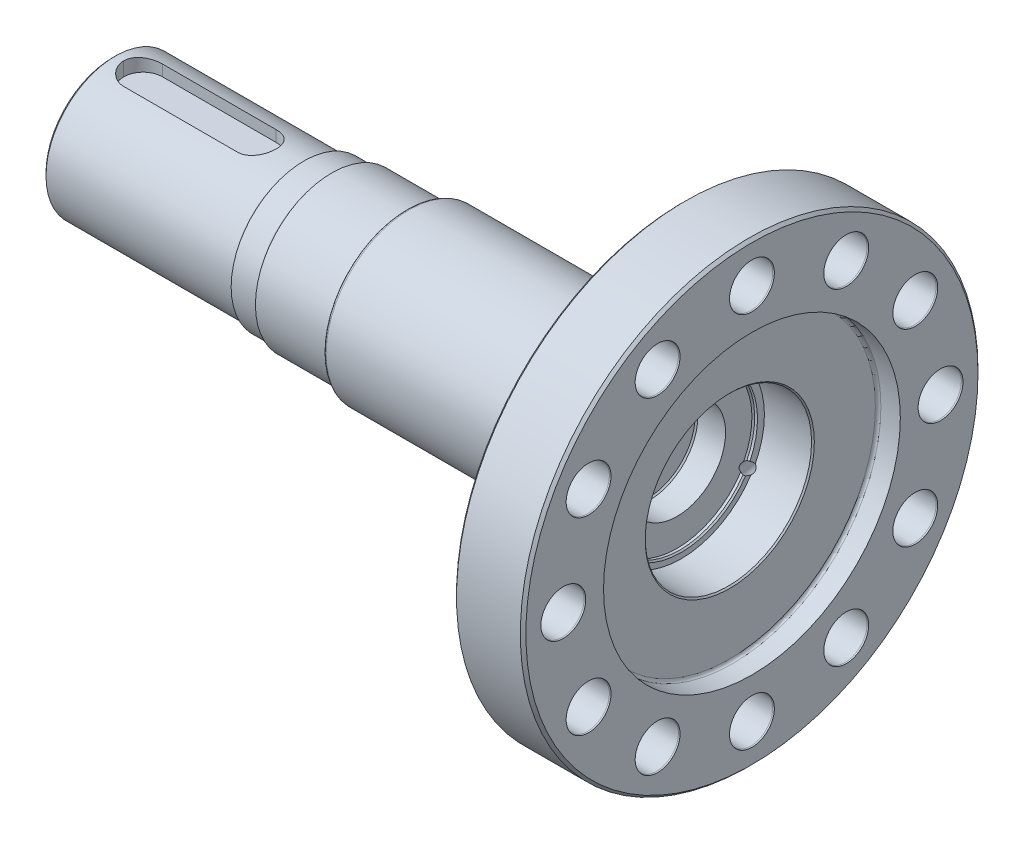
from build123d import *

# Parameters (mm, degrees)
SKETCH_2_R                            = 165
EXTRUDE_1_DEPTH                       = 50
SKETCH_5_R                            = 110
EXTRUDE_2_DEPTH                       = 55
EXTRUDE_2_TAPER                       = 30
SKETCH_7_R                            = 60
EXTRUDE_3_DEPTH                       = 144
SKETCH_8_R                            = 55
EXTRUDE_4_DEPTH                       = 54
SKETCH_9_R                            = 52.5
UNDEF_DEPTH                           = 20
SKETCH_10_R                           = 50
EXTRUDE_6_DEPTH                       = 138
CUT_EXTRUDE_START                     = -118
CUT_EXTRUDE_1_DEPTH                   = 110
FILLET_1_R                            = 14
HOLE_WIZARD_M12_2_D                   = 10.2
HOLE_WIZARD_M12_2_DEPTH               = 36.935610843
HOLE_WIZARD_M12_2_TIP                 = 3.064389157
SKETCH_17_R                           = 107
CUT_EXTRUDE_2_DEPTH                   = 16
SKETCH_18_R                           = 60
CUT_EXTRUDE_3_DEPTH                   = 35
SKETCH_19_R                           = 55
CUT_EXTRUDE_4_DEPTH                   = 3
SKETCH_20_R                           = 35
CUT_EXTRUDE_5_DEPTH                   = 21
CUT_EXTRUDE_6_REACH                   = 518.692
SKETCH_21_R                           = 16
CHAMFER_1_SIZE                        = 1
CHAMFER_1_SIZE2                       = 0.176326981
PATTERN_CIRCULAR_1_COUNT              = 12
CHAMFER_1_OF_PATTERN_CIRCULAR_1_SIZE2 = 1
CHAMFER_1_OF_PATTERN_CIRCULAR_1_SIZE  = 0.176326981
CUT_EXTRUDE_7_REACH                   = 512.257
SKETCH_22_R                           = 4
PATTERN_CIRCULAR_2_COUNT              = 3
CHAMFER_2_SIZE                        = 2
FILLET_2_R                            = 2
CHAMFER_3_SIZE                        = 1
FILLET_3_R                            = 2


with BuildPart() as part:
    # 草图2 → 凸台-拉伸1 (new body)
    with BuildSketch(Plane(origin=(0, 0, 0), x_dir=(0, 0, -1), z_dir=(1, 0, 0))):
        Circle(SKETCH_2_R)
    extrude(amount=-EXTRUDE_1_DEPTH)

    # 草图5 → 凸台-拉伸2 (add)
    with BuildSketch(Plane.ZY.offset(50)):
        Circle(SKETCH_5_R)
    extrude(amount=EXTRUDE_2_DEPTH, taper=EXTRUDE_2_TAPER)

    # 草图7 → 凸台-拉伸3 (add)
    with BuildSketch(Plane.ZY.offset(105)):
        Circle(SKETCH_7_R)
    extrude(amount=EXTRUDE_3_DEPTH)

    # 草图8 → 凸台-拉伸4 (add)
    with BuildSketch(Plane.ZY.offset(249)):
        Circle(SKETCH_8_R)
    extrude(amount=EXTRUDE_4_DEPTH)

    # 草图9 → undef (add)
    with BuildSketch(Plane.ZY.offset(303)):
        Circle(SKETCH_9_R)
    extrude(amount=UNDEF_DEPTH)

    # 草图10 → 凸台-拉伸6 (add)
    with BuildSketch(Plane.ZY.offset(323)):
        Circle(SKETCH_10_R)
    extrude(amount=EXTRUDE_6_DEPTH)

    # 草图11 → 切除-拉伸1 (cut)
    with BuildSketch(Plane.ZY.offset(461).offset(CUT_EXTRUDE_START)):
        with BuildLine():
            Line((-14, 48), (-14, 40))
            Line((-14, 40), (14, 40))
            Line((14, 40), (14, 48))
            ThreePointArc((14, 48), (0, 50), (-14, 48))
        make_face()
    extrude(amount=CUT_EXTRUDE_1_DEPTH, mode=Mode.SUBTRACT)

    # 圆角1
    # the kernel refuses this fillet: 14 mm, written as the material it adds along each edge
    with BuildSketch(Plane(origin=(-343, 83, -14), x_dir=(0, 0, 1), z_dir=(0, -1, 0))) as fillet_1_piece_1_section:
        with BuildLine():
            CenterArc((FILLET_1_R, FILLET_1_R), FILLET_1_R, 180, 90)
            Line((0, FILLET_1_R), (0, 0))
            Line((0, 0), (FILLET_1_R, 0))
        make_face()
    fillet_1_piece_1 = extrude(amount=78, mode=Mode.PRIVATE)
    fillet_1_piece_1 = fillet_1_piece_1 & Plane(origin=(-346.044512789, 0, 0), x_dir=(0, 0, 1), z_dir=(1, 0, 0)) * Cylinder(50, 212, mode=Mode.PRIVATE)
    add(fillet_1_piece_1)
    with BuildSketch(Plane(origin=(-453, 5, 14), x_dir=(1, 0, 0), z_dir=(0, 1, 0))) as fillet_1_piece_2_section:
        with BuildLine():
            CenterArc((FILLET_1_R, FILLET_1_R), FILLET_1_R, 180, 90)
            Line((0, FILLET_1_R), (0, 0))
            Line((0, 0), (FILLET_1_R, 0))
        make_face()
    fillet_1_piece_2 = extrude(amount=78, mode=Mode.PRIVATE)
    fillet_1_piece_2 = fillet_1_piece_2 & Plane(origin=(-449.8304684, 0, 0), x_dir=(0, 0, 1), z_dir=(1, 0, 0)) * Cylinder(50, 212, mode=Mode.PRIVATE)
    add(fillet_1_piece_2)
    with BuildSketch(Plane(origin=(-343, 5, 14), x_dir=(0, 0, -1), z_dir=(0, 1, 0))) as fillet_1_piece_3_section:
        with BuildLine():
            CenterArc((FILLET_1_R, FILLET_1_R), FILLET_1_R, 180, 90)
            Line((0, FILLET_1_R), (0, 0))
            Line((0, 0), (FILLET_1_R, 0))
        make_face()
    fillet_1_piece_3 = extrude(amount=78, mode=Mode.PRIVATE)
    fillet_1_piece_3 = fillet_1_piece_3 & Plane(origin=(-346.1695316, 0, 0), x_dir=(0, 0, 1), z_dir=(1, 0, 0)) * Cylinder(50, 212, mode=Mode.PRIVATE)
    add(fillet_1_piece_3)
    with BuildSketch(Plane(origin=(-453, 83, -14), x_dir=(0, 0, 1), z_dir=(0, -1, 0))) as fillet_1_piece_4_section:
        with BuildLine():
            CenterArc((FILLET_1_R, -FILLET_1_R), FILLET_1_R, 90, 90)
            Line((0, -FILLET_1_R), (0, 0))
            Line((0, 0), (FILLET_1_R, 0))
        make_face()
    fillet_1_piece_4 = extrude(amount=78, mode=Mode.PRIVATE)
    fillet_1_piece_4 = fillet_1_piece_4 & Plane(origin=(-449.955487211, 0, 0), x_dir=(0, 0, 1), z_dir=(1, 0, 0)) * Cylinder(50, 212, mode=Mode.PRIVATE)
    add(fillet_1_piece_4)

    # 草图12 → 切除-旋转2 (revolve, cut)
    with BuildSketch(Plane(origin=(0, 0, 0), x_dir=(1, 0, 0), z_dir=(0, 1, 0)), mode=Mode.PRIVATE) as cut_revolve_2_sk:
        Polygon((-461, 17), (-459.845299462, 15), (-445.122867597, 6.5), (-445.122867597, 0), (-461, 0), align=None)
    revolve(cut_revolve_2_sk.sketch.rotate(Axis((-461, 0, 0), (1, 0, 0)), 180), axis=Axis((-461, 0, 0), (1, 0, 0)), mode=Mode.SUBTRACT)

    # M12 螺纹孔2
    with Locations(Plane.ZY.offset(461)):
        with Locations((0, 0)):
            Hole(HOLE_WIZARD_M12_2_D / 2, depth=HOLE_WIZARD_M12_2_DEPTH)
            with Locations((0, 0, -(HOLE_WIZARD_M12_2_DEPTH + HOLE_WIZARD_M12_2_TIP / 2))):  # 118° drill point
                Cone(0, HOLE_WIZARD_M12_2_D / 2, HOLE_WIZARD_M12_2_TIP, mode=Mode.SUBTRACT)

    # 草图17 → 切除-拉伸2 (cut)
    with BuildSketch(Plane(origin=(0, 0, 0), x_dir=(0, 0, -1), z_dir=(1, 0, 0))):
        Circle(SKETCH_17_R)
    extrude(amount=-CUT_EXTRUDE_2_DEPTH, mode=Mode.SUBTRACT)

    # 草图18 → 切除-拉伸3 (cut)
    with BuildSketch(Plane(origin=(-16, 0, 0), x_dir=(0, 0, -1), z_dir=(1, 0, 0))):
        with Locations(Location((0, 0, 0), (0, 0, 180))):
            Circle(SKETCH_18_R)
    extrude(amount=-CUT_EXTRUDE_3_DEPTH, mode=Mode.SUBTRACT)

    # 草图19 → 切除-拉伸4 (cut)
    with BuildSketch(Plane(origin=(-51, 0, 0), x_dir=(0, 0, -1), z_dir=(1, 0, 0))):
        with Locations(Location((0, 0, 0), (0, 0, 180))):
            Circle(SKETCH_19_R)
    extrude(amount=-CUT_EXTRUDE_4_DEPTH, mode=Mode.SUBTRACT)

    # 草图20 → 切除-拉伸5 (cut)
    with BuildSketch(Plane(origin=(-54, 0, 0), x_dir=(0, 0, -1), z_dir=(1, 0, 0))):
        Circle(SKETCH_20_R)
    extrude(amount=-CUT_EXTRUDE_5_DEPTH, mode=Mode.SUBTRACT)

    # 草图21 → 切除-拉伸6 (cut, up to next)
    with BuildSketch(Plane(origin=(0, 0, 0), x_dir=(0, 0, -1), z_dir=(1, 0, 0)), mode=Mode.PRIVATE) as cut_extrude_6_sk1:
        with Locations((0, -136)):
            Circle(SKETCH_21_R)
    cut_extrude_6_tool1 = extrude(cut_extrude_6_sk1.sketch, amount=-CUT_EXTRUDE_6_REACH, mode=Mode.PRIVATE) & part.part
    cut_extrude_6 = cut_extrude_6_tool1.solids().sort_by_distance((0, -136, 0))[0]
    add(cut_extrude_6, mode=Mode.SUBTRACT)

    # 倒角1
    chamfer_1_edges = [part.edges().sort_by_distance(p)[0] for p in [
        (0, -136, 16),
    ]]
    chamfer_1_side = [part.faces().sort_by_distance(p)[0] for p in [
        (-25, -136, 16),
    ]]
    chamfer(chamfer_1_edges, length=CHAMFER_1_SIZE, length2=CHAMFER_1_SIZE2, reference=chamfer_1_side[0])

    # 阵列(圆周)1: 切除-拉伸6 ×12 about axis
    pattern_circular_1_axis = Axis((0, 0, 0), (1, 0, 0))
    for i in range(1, PATTERN_CIRCULAR_1_COUNT):
        add(cut_extrude_6.rotate(pattern_circular_1_axis, i * 360 / PATTERN_CIRCULAR_1_COUNT), mode=Mode.SUBTRACT)

    # 倒角1 of 阵列(圆周)1
    chamfer_1_of_pattern_circular_1_edges = [part.edges().sort_by_distance(p)[0] for p in [
        (0, -125.779454915, -54.143593539),
        (0, -81.856406461, -109.779454915),
        (0, -16, -136),
        (0, 54.143593539, -125.779454915),
        (0, 109.779454915, -81.856406461),
        (0, 136, -16),
        (0, 125.779454915, 54.143593539),
        (0, 81.856406461, 109.779454915),
        (0, 16, 136),
        (0, -54.143593539, 125.779454915),
        (0, -109.779454915, 81.856406461),
    ]]
    chamfer(chamfer_1_of_pattern_circular_1_edges, length=CHAMFER_1_OF_PATTERN_CIRCULAR_1_SIZE, length2=CHAMFER_1_OF_PATTERN_CIRCULAR_1_SIZE2)

    # 草图22 → 切除-拉伸7 (cut, up to next)
    with BuildSketch(Plane(origin=(-60.131397208, 104.150635095, 0), x_dir=(0.866025403784438, 0.5000000000000012, 0), z_dir=(-0.5000000000000011, 0.8660254037844379, 0)), mode=Mode.PRIVATE) as cut_extrude_7_sk1:
        with Locations(Location((-16.8097998, 0, 0), (0, 0, 133.68190418))):
            Circle(SKETCH_22_R)
    cut_extrude_7_tool1 = extrude(cut_extrude_7_sk1.sketch, amount=-CUT_EXTRUDE_7_REACH, mode=Mode.PRIVATE) & part.part
    cut_extrude_7 = cut_extrude_7_tool1.solids().sort_by_distance((-74.689111, 95.745735, 0))[0]
    add(cut_extrude_7, mode=Mode.SUBTRACT)

    # 阵列(圆周)2: 切除-拉伸7 ×3 about axis
    pattern_circular_2_axis = Axis((-50, 0, 0), (1, 0, 0))
    for i in range(1, PATTERN_CIRCULAR_2_COUNT):
        add(cut_extrude_7.rotate(pattern_circular_2_axis, i * 360 / PATTERN_CIRCULAR_2_COUNT), mode=Mode.SUBTRACT)

    # 倒角2
    chamfer_2_edges = [part.edges().sort_by_distance(p)[0] for p in [
        (0, 0, 165),
        (-461, 0, -50),
        (-50, 0, 165),
    ]]
    chamfer(chamfer_2_edges, length=CHAMFER_2_SIZE)

    # 圆角2
    fillet_2_edges = [part.edges().sort_by_distance(p)[0] for p in [
        (-105, 0, -60),
        (-249, 0, -60),
        (-249, 0, -55),
        (-303, 0, -52.5),
        (-323, 0, -50),
    ]]
    fillet(fillet_2_edges, radius=FILLET_2_R)

    # 倒角3
    # the kernel refuses this chamfer: 1 mm, written as the material it adds along each edge
    with BuildSketch(Plane(origin=(-75, 0, 0), x_dir=(0, 0, -1), z_dir=(0, -1, 0))) as chamfer_3_piece_1:
        Polygon((35, CHAMFER_3_SIZE), (35 - CHAMFER_3_SIZE, 0), (35, 0), align=None)
    revolve(axis=Axis((-75, 0, 0), (1, 0, 0)))
    with BuildSketch(Plane(origin=(-54, 0, 0), x_dir=(0, -0.4913004655885946, -0.8709901563809032), z_dir=(0, -0.8709901563809032, 0.4913004655885946))) as chamfer_3_piece_2_section:
        Polygon((55 - CHAMFER_3_SIZE, 0), (55, CHAMFER_3_SIZE), (55, 0), align=None)
    chamfer_3_piece_2 = revolve(axis=Axis((-54, 0, 0), (1, 0, 0)), revolution_arc=118.852186591, mode=Mode.PRIVATE)
    chamfer_3_piece_2 = chamfer_3_piece_2 - Plane(origin=(-39.745186792, 35.22108328, 0), x_dir=(-0.5981239444931611, -0.3453270203618884, -0.7231853123729228), z_dir=(-0.5000000000000012, 0.866025403784438, 0)) * Cylinder(4, 221, mode=Mode.PRIVATE)
    chamfer_3_piece_2 = chamfer_3_piece_2 - Plane(origin=(-39.745186792, -17.61054164, -30.502352869), x_dir=(-0.5981239444931611, -0.45363334197779126, 0.6606546284330431), z_dir=(-0.5000000000000012, -0.4330127018922194, -0.7499999999999992)) * Cylinder(4, 221, mode=Mode.PRIVATE)
    add(chamfer_3_piece_2)
    # the kernel refuses this chamfer: 1 mm, written as the material it takes off along each edge
    with BuildSketch(Plane(origin=(-16, 0, 0), x_dir=(0, 0, 1), z_dir=(0, 1, 0))) as chamfer_3_2_piece_1:
        Polygon((60, -CHAMFER_3_SIZE), (60 + CHAMFER_3_SIZE, 0), (60, 0), align=None)
    revolve(axis=Axis((-16, 0, 0), (1, 0, 0)), mode=Mode.SUBTRACT)
    with BuildSketch(Plane(origin=(-51, 0, 0), x_dir=(0, -0.47732244185998407, 0.8787282210654339), z_dir=(0, -0.8787282210654339, -0.47732244185998407))) as chamfer_3_2_piece_2:
        Polygon((55 + CHAMFER_3_SIZE, 0), (55, CHAMFER_3_SIZE), (55, 0), align=None)
    revolve(axis=Axis((-51, 0, 0), (-1, 0, 0)), revolution_arc=117.021344007, mode=Mode.SUBTRACT)
    with BuildSketch(Plane(origin=(-51, 0, 0), x_dir=(0, -0.5223397415349813, 0.8527374709798844), z_dir=(0, 0.8527374709798844, 0.5223397415349813))) as chamfer_3_2_piece_3:
        Polygon((55, -CHAMFER_3_SIZE), (55 + CHAMFER_3_SIZE, 0), (55, 0), align=None)
    revolve(axis=Axis((-51, 0, 0), (1, 0, 0)), revolution_arc=117.021344007, mode=Mode.SUBTRACT)

    # 圆角3
    fillet_3_edges = [part.edges().sort_by_distance(p)[0] for p in [
        (-16, 0, 107),
    ]]
    fillet(fillet_3_edges, radius=FILLET_3_R)


solid = part.part
